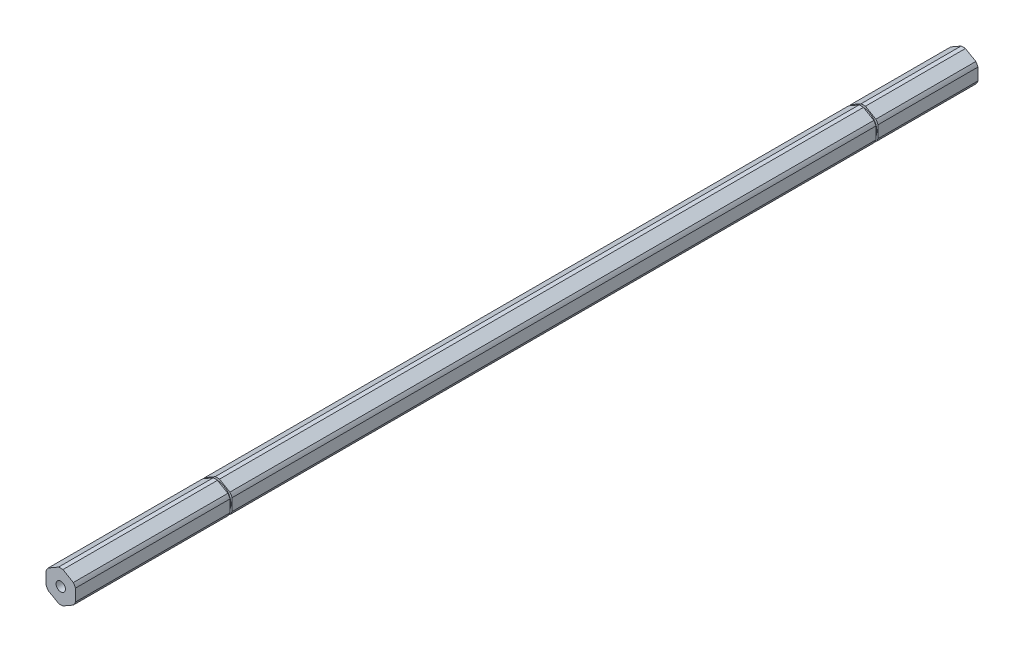
from build123d import *

# Parameters (mm, degrees)
BOSS_EXTRUDE1_DEPTH        = 194.32016
F_10_32_TAPPED_HOLE1_D     = 4.0386
F_10_32_TAPPED_HOLE1_DEPTH = 11.938
F_10_32_TAPPED_HOLE1_TIP   = 1.213317848
SKETCH6_R                  = 3.175
CUT_EXTRUDE2_DEPTH         = 6.35
SKETCH8_W                  = 3.175
SKETCH8_H                  = 0.889


with BuildPart() as part:
    # Sketch1 → Boss-Extrude1 (new, symmetric)
    with BuildSketch(Plane.XY):
        with BuildLine():
            ThreePointArc((0.93173274, 6.79441227), (0, 6.858), (-0.93173274, 6.79441227))
            Line((-0.93173274, 6.79441227), (-5.41826726, 4.204110358))
            ThreePointArc((-5.41826726, 4.204110358), (-5.939202219, 3.429), (-6.35, 2.590301913))
            Line((-6.35, 2.590301913), (-6.35, -2.590301913))
            ThreePointArc((-6.35, -2.590301913), (-5.939202219, -3.429), (-5.41826726, -4.204110358))
            Line((-5.41826726, -4.204110358), (-0.93173274, -6.79441227))
            ThreePointArc((-0.93173274, -6.79441227), (0, -6.858), (0.93173274, -6.79441227))
            Line((0.93173274, -6.79441227), (5.41826726, -4.204110358))
            ThreePointArc((5.41826726, -4.204110358), (5.939202219, -3.429), (6.35, -2.590301913))
            Line((6.35, -2.590301913), (6.35, 2.590301913))
            ThreePointArc((6.35, 2.590301913), (5.939202219, 3.429), (5.41826726, 4.204110358))
            Line((5.41826726, 4.204110358), (0.93173274, 6.79441227))
        make_face()
    extrude(amount=BOSS_EXTRUDE1_DEPTH, both=True)

    # #10-32 Tapped Hole1
    with Locations(Plane.XY.offset(194.32016)):
        with Locations((0, 0)):
            Hole(F_10_32_TAPPED_HOLE1_D / 2, depth=F_10_32_TAPPED_HOLE1_DEPTH)
            with Locations((0, 0, -(F_10_32_TAPPED_HOLE1_DEPTH + F_10_32_TAPPED_HOLE1_TIP / 2))):  # 118° drill point
                Cone(0, F_10_32_TAPPED_HOLE1_D / 2, F_10_32_TAPPED_HOLE1_TIP, mode=Mode.SUBTRACT)

    # Sketch6 → Cut-Extrude2 (cut)
    with BuildSketch(Plane(origin=(0, 0, -194.32016), x_dir=(-1, 0, 0), z_dir=(0, 0, -1))):
        Circle(SKETCH6_R)
    extrude(amount=-CUT_EXTRUDE2_DEPTH, mode=Mode.SUBTRACT)

    # Sketch8 → Cut-Revolve5 (revolve, cut)
    with BuildSketch(Plane(origin=(0, 0, 0), x_dir=(1, 0, 0), z_dir=(0, 1, 0))):
        with Locations((7.4422, 150.82266)):
            Rectangle(SKETCH8_W, SKETCH8_H)
        with Locations((7.4422, -127.32766)):
            Rectangle(SKETCH8_W, SKETCH8_H)
    revolve(axis=Axis((0, 0, -194.32016), (0, 0, 1)), mode=Mode.SUBTRACT)


solid = part.part
